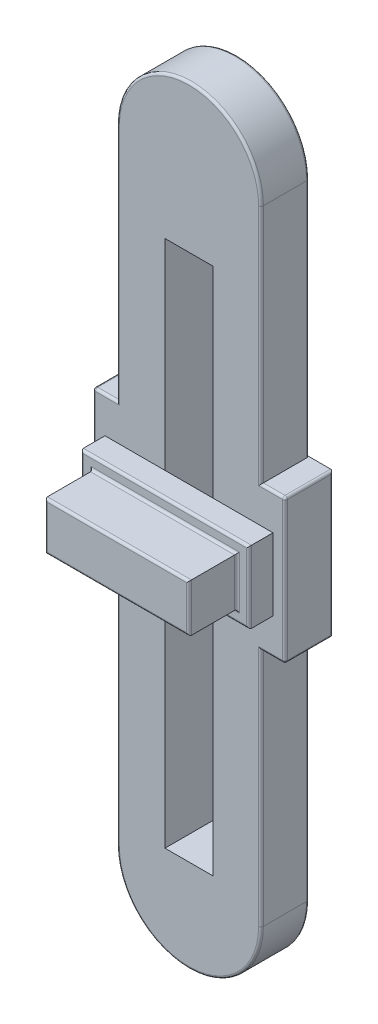
from build123d import *

# Parameters (mm, degrees)
BOSS_EXTRUDE1_DEPTH = 508
SKETCH2_W           = 1524
SKETCH2_H           = 508
BOSS_EXTRUDE3_DEPTH = 762
SKETCH3_W           = 1778
SKETCH3_H           = 762
SKETCH3_W_2         = 1524
SKETCH3_H_2         = 508
BOSS_EXTRUDE4_DEPTH = 254
FILLET1_R           = 25.4
FILLET2_R           = 25.4
FILLET3_R           = 25.4


with BuildPart() as part:
    # Sketch1 → Boss-Extrude1 (new body)
    with BuildSketch(Plane.XY):
        with BuildLine():
            Line((762, 0), (762, -2540))
            Line((762, -2540), (1016, -2540))
            Line((1016, -2540), (1016, -4064))
            Line((1016, -4064), (762, -4064))
            Line((762, -4064), (762, -6604))
            ThreePointArc((762, -6604), (0, -7366), (-762, -6604))
            Line((-762, -6604), (-762, -4064))
            Line((-762, -4064), (-1016, -4064))
            Line((-1016, -4064), (-1016, -2540))
            Line((-1016, -2540), (-762, -2540))
            Line((-762, -2540), (-762, 0))
            ThreePointArc((-762, 0), (0, 762), (762, 0))
        make_face()
        Polygon((0, -795.153480501), (-254, -795.153480501), (-254, -6383.153480501), (0, -6383.153480501), (254, -6383.153480501), (254, -795.153480501), align=None, mode=Mode.SUBTRACT)
    extrude(amount=BOSS_EXTRUDE1_DEPTH)

    # Sketch2 → Boss-Extrude3 (add)
    with BuildSketch(Plane.XY.offset(508)):
        with Locations((0, -3302)):
            Rectangle(SKETCH2_W, SKETCH2_H)
    extrude(amount=BOSS_EXTRUDE3_DEPTH)

    # Sketch3 → Boss-Extrude4 (add)
    with BuildSketch(Plane.XY.offset(508)):
        with Locations((0, -3302)):
            Rectangle(SKETCH3_W, SKETCH3_H)
        with Locations((0, -3302)):
            Rectangle(SKETCH3_W_2, SKETCH3_H_2, mode=Mode.SUBTRACT)
    extrude(amount=BOSS_EXTRUDE4_DEPTH)

    # Fillet1
    fillet1_edges = [part.edges().sort_by_distance(p)[0] for p in [
        (762, -3302, 1270),
        (0, -3048, 1270),
        (-762, -3302, 1270),
        (0, -3556, 1270),
        (0, -3683, 762),
        (889, -3302, 762),
        (0, -2921, 762),
        (-889, -3302, 762),
        (0, -3556, 762),
        (762, -3302, 762),
        (0, -3048, 762),
        (-762, -3302, 762),
    ]]
    fillet(fillet1_edges, radius=FILLET1_R)

    # Fillet2
    fillet2_edges = [part.edges().sort_by_distance(p)[0] for p in [
        (1016, -4064, 254),
        (-889, -2540, 0),
        (-889, -2540, 508),
        (0, -7366, 508),
        (0, -7366, 0),
        (-762, -1270, 508),
        (-762, -1270, 0),
        (0, 762, 508),
        (0, 762, 0),
        (762, -1270, 0),
        (-889, -4064, 0),
        (-889, -4064, 508),
        (-1016, -3302, 508),
        (-1016, -3302, 0),
        (-762, -5334, 0),
        (-762, -5334, 508),
        (762, -5334, 0),
        (1016, -3302, 0),
        (1016, -2540, 254),
        (762, -1270, 508),
        (889, -2540, 508),
        (889, -4064, 508),
        (762, -5334, 508),
        (1016, -3302, 508),
    ]]
    fillet(fillet2_edges, radius=FILLET2_R)

    # Fillet3
    # the kernel refuses this fillet: 25.4 mm, written as the material it takes off along each edge
    with BuildSketch(Plane(origin=(-990.6, -2565.4, 482.6), x_dir=(-1, 0, 0), z_dir=(0, 1, 0))) as fillet3_piece_1_section:
        Polygon((0, 0), (FILLET3_R * 1.02, 0), (FILLET3_R * 1.02, FILLET3_R * 1.02), (0, FILLET3_R * 1.02), align=None)
    fillet3_piece_1 = extrude(amount=FILLET3_R * 1.02, mode=Mode.PRIVATE)
    fillet3_piece_1 = fillet3_piece_1 - Plane(origin=(-990.6, -2565.4, 482.6), x_dir=(0.7071067811865475, 0, -0.7071067811865475), z_dir=(0, 1, 0)) * Sphere(FILLET3_R, mode=Mode.PRIVATE)
    with BuildSketch(Plane(origin=(-990.6, -4038.6, 482.6), x_dir=(0, -1, 0), z_dir=(-1, 0, 0))) as fillet3_piece_2_section:
        Polygon((0, 0), (FILLET3_R * 1.02, 0), (FILLET3_R * 1.02, FILLET3_R * 1.02), (0, FILLET3_R * 1.02), align=None)
    fillet3_piece_2 = extrude(amount=FILLET3_R * 1.02, mode=Mode.PRIVATE)
    fillet3_piece_2 = fillet3_piece_2 - Plane(origin=(-990.6, -4038.6, 482.6), x_dir=(0, 0.7071067811865475, -0.7071067811865475), z_dir=(-1, 0, 0)) * Sphere(FILLET3_R, mode=Mode.PRIVATE)
    with BuildSketch(Plane(origin=(-990.6, -4038.6, 25.4), x_dir=(0, -1, 0), z_dir=(-1, 0, 0))) as fillet3_piece_3_section:
        Polygon((0, 0), (FILLET3_R * 1.02, 0), (FILLET3_R * 1.02, -FILLET3_R * 1.02), (0, -FILLET3_R * 1.02), align=None)
    fillet3_piece_3 = extrude(amount=FILLET3_R * 1.02, mode=Mode.PRIVATE)
    fillet3_piece_3 = fillet3_piece_3 - Plane(origin=(-990.6, -4038.6, 25.4), x_dir=(0, 0.7071067811865475, 0.7071067811865475), z_dir=(-1, 0, 0)) * Sphere(FILLET3_R, mode=Mode.PRIVATE)
    with BuildSketch(Plane(origin=(-990.6, -2565.4, 25.4), x_dir=(-1, 0, 0), z_dir=(0, 1, 0))) as fillet3_piece_4_section:
        Polygon((0, 0), (FILLET3_R * 1.02, 0), (FILLET3_R * 1.02, -FILLET3_R * 1.02), (0, -FILLET3_R * 1.02), align=None)
    fillet3_piece_4 = extrude(amount=FILLET3_R * 1.02, mode=Mode.PRIVATE)
    fillet3_piece_4 = fillet3_piece_4 - Plane(origin=(-990.6, -2565.4, 25.4), x_dir=(0.7071067811865475, 0, 0.7071067811865475), z_dir=(0, 1, 0)) * Sphere(FILLET3_R, mode=Mode.PRIVATE)
    with BuildSketch(Plane(origin=(-1016, -2540, 25.4), x_dir=(1, 0, 0), z_dir=(0, 0, 1)), Plane(origin=(-1016, -4064, 25.4), x_dir=(0, 1, 0), z_dir=(0, 0, 1))) as fillet3_piece_5:
        with BuildLine():
            CenterArc((FILLET3_R, -FILLET3_R), FILLET3_R, 90, 90)
            Line((0, -FILLET3_R), (0, 0))
            Line((0, 0), (FILLET3_R, 0))
        make_face()
    fillet3_piece_5_solid = extrude(amount=457.2, mode=Mode.PRIVATE)
    add([fillet3_piece_1, fillet3_piece_2, fillet3_piece_3, fillet3_piece_4, fillet3_piece_5_solid], mode=Mode.SUBTRACT)


solid = part.part
